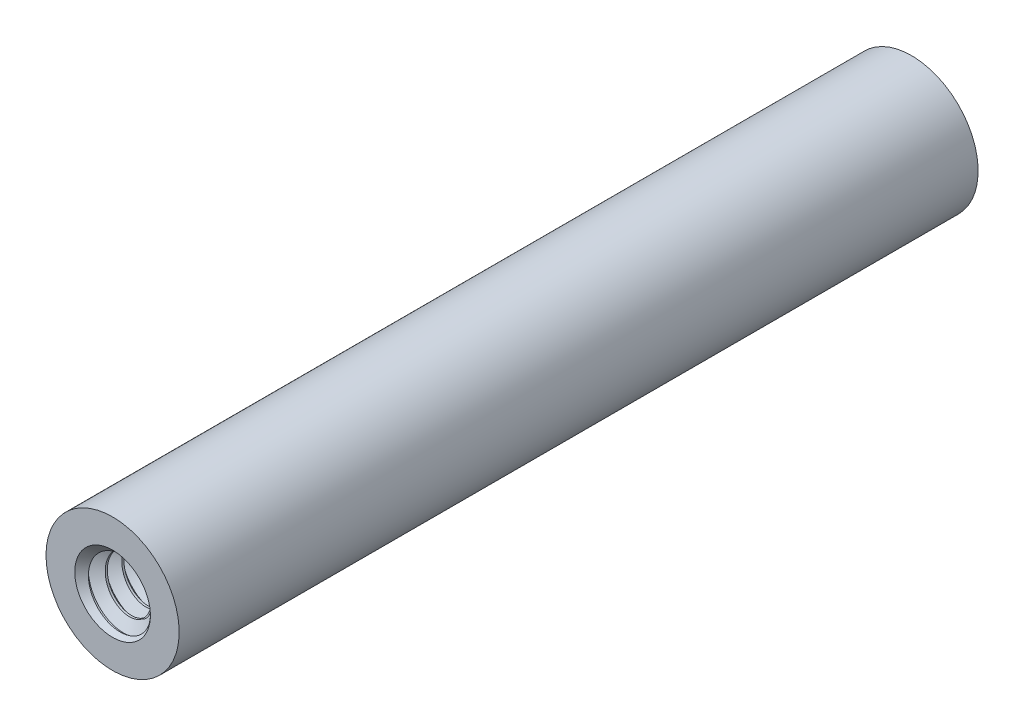
from build123d import *

# Parameters (mm, degrees)
EXTRUDE1_DEPTH      = 19.05
EXTRUDE1_DEPTH_BACK = 19.05
SKETCH1_R           = 3.175
SKETCH1_R_2         = 1.7526
SWEEP1_PITCH        = 0.79375
SKETCH6_R           = 3.175
EXTRUDE2_DEPTH      = 40.152247973
SKETCH9_W           = 19.05
SKETCH9_H           = 1.8034


with BuildPart() as part:
    # Sketch1 → Extrude1 (new, two sides: drawn at the far end of the back side and taken through both)
    with BuildSketch(Plane.XY.offset(-EXTRUDE1_DEPTH_BACK)):
        with Locations(Location((0, 0, 0), (0, 0, 180))):
            Circle(SKETCH1_R)
        with Locations(Location((0, 0, 0), (0, 0, 180))):
            Circle(SKETCH1_R_2, mode=Mode.SUBTRACT)
    extrude(amount=EXTRUDE1_DEPTH + EXTRUDE1_DEPTH_BACK)

    # Sweep1: arcs per turn and ends read off the stored shape
    # Sweep1: the profile of Sketch12 profile screwed along a right-hand helix through 49 turns, 8 arcs to a turn; built about Z, then put on its axis
    sweep1_z = Axis((0, 0, 0), (0, 0, 1))
    sweep1_corners = [(1.7529, 0, -0.694704455), (1.7529, 0, 0.000173205), (1.237044252, 0, -0.29765625), (1.237044252, 0, -0.396875)]
    with BuildLine(mode=Mode.PRIVATE) as sweep1_profile:
        Line(sweep1_corners[0], sweep1_corners[1])
        Line(sweep1_corners[1], sweep1_corners[2])
        Line(sweep1_corners[2], sweep1_corners[3])
        Line(sweep1_corners[3], sweep1_corners[0])
    sweep1_cap = Face(sweep1_profile.wire())
    sweep1_turn_angles = [0, 22.5, 45, 67.5, 90, 112.5, 135, 157.5, 180, 202.5, 225, 247.5, 270, 292.5, 315, 337.5, 360]
    sweep1_turn_weights = [1, 0.9238795325112867, 1, 0.9238795325112867, 1, 0.9238795325112867, 1, 0.9238795325112867, 1, 0.9238795325112867, 1, 0.9238795325112867, 1, 0.9238795325112867, 1, 0.9238795325112867, 1]
    sweep1_turn_rails = [Edge.make_bspline([Vector(p[0], p[1], 0).rotate(sweep1_z, sweep1_turn_angles[k]) / sweep1_turn_weights[k] + Vector(0, 0, p[2] + SWEEP1_PITCH * sweep1_turn_angles[k] / 360) for k in range(17)], [0, 0, 0, 1, 1, 2, 2, 3, 3, 4, 4, 5, 5, 6, 6, 7, 7, 8, 8, 8], 2, sweep1_turn_weights) for p in sweep1_corners]
    sweep1_turn_sides = [Face.make_surface_from_curves(sweep1_turn_rails[p[0]], sweep1_turn_rails[p[1]]) for p in [(0, 1), (1, 2), (2, 3), (3, 0)]]
    sweep1 = Plane(origin=(0, 0, -19.05), x_dir=(0, 1, 0), z_dir=(0, 0, 1)) * Solid(Shell([*[p.moved(Location((0, 0, SWEEP1_PITCH * i))) for i in range(49) for p in sweep1_turn_sides], sweep1_cap, sweep1_cap.rotate(sweep1_z, 17640).moved(Location((0, 0, SWEEP1_PITCH * 17640 / 360)))]))
    add(sweep1)

    # Sketch6 → Extrude2 (cut, through all)
    with BuildSketch(Plane(origin=(0, 0, -19.05), x_dir=(-1, 0, 0), z_dir=(0, 0, -1))):
        Circle(SKETCH6_R)
    extrude2 = extrude(amount=EXTRUDE2_DEPTH, mode=Mode.SUBTRACT)

    # Extrude3 cone 1 section (through the dimple's axis) → Extrude3 (revolve, cut)
    with BuildSketch(Plane(origin=(0, 0, -19.05), x_dir=(0, 1, 0), z_dir=(1, 0, 0))):
        Polygon((0, 0), (1.8034, 0), (0, 1.933909732), align=None)
    extrude3 = revolve(axis=Axis((0, 0, -19.05), (0, 0, 1)), mode=Mode.SUBTRACT)

    # Mirror1: Extrude2, Extrude3 across plane
    add(extrude2.mirror(Plane.XY), mode=Mode.SUBTRACT)
    add(extrude3.mirror(Plane.XY), mode=Mode.SUBTRACT)

    # Sketch9 → Revolve 2 (revolve)
    with BuildSketch(Plane(origin=(0, 0, 0), x_dir=(0, 0, -1), z_dir=(1, 0, 0)), mode=Mode.PRIVATE) as revolve_2_sk:
        with Locations((0, 0.9017)):
            Rectangle(SKETCH9_W, SKETCH9_H)
    revolve(revolve_2_sk.sketch.rotate(Axis((0, 0, 19.05), (0, 0, -1)), 270), axis=Axis((0, 0, 19.05), (0, 0, -1)))


solid = part.part
